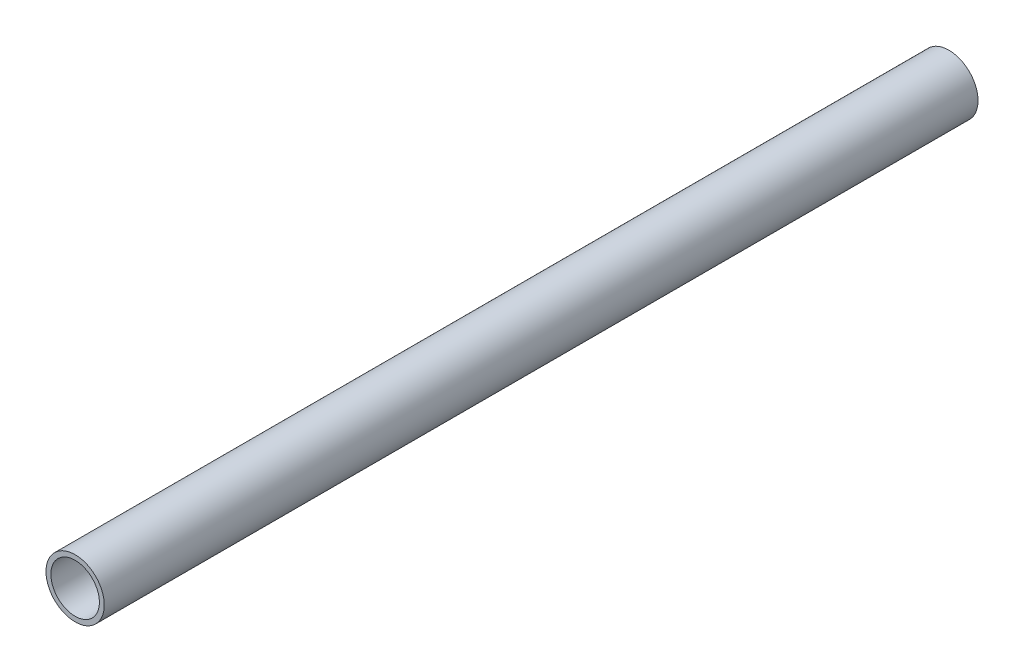
from build123d import *

# Parameters (mm, degrees)
SKETCH1_R           = 6
SKETCH1_R_2         = 5
BOSS_EXTRUDE1_DEPTH = 180


with BuildPart() as part:
    # Sketch1 → Boss-Extrude1 (new body)
    with BuildSketch(Plane.XY):
        Circle(SKETCH1_R)
        Circle(SKETCH1_R_2, mode=Mode.SUBTRACT)
    extrude(amount=BOSS_EXTRUDE1_DEPTH)


solid = part.part
